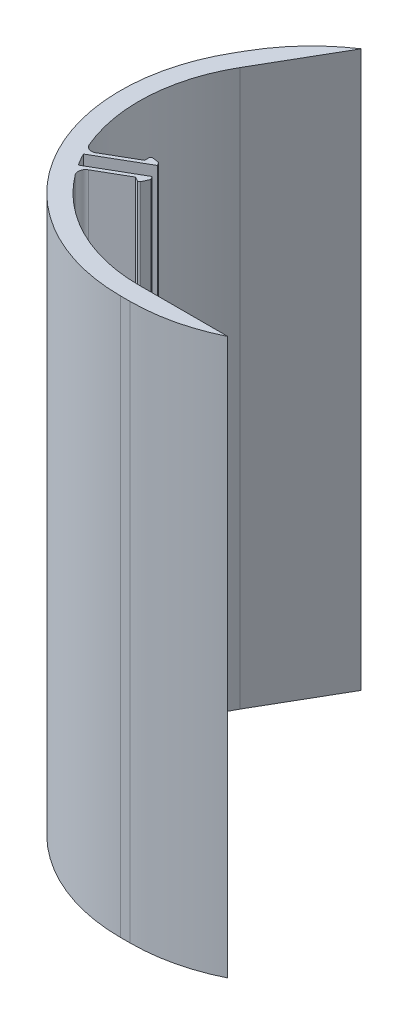
from build123d import *

# Parameters (mm, degrees)
BOSS_EXTRUDE1_DEPTH     = 150
FILLET1_R               = 48
CUT_EXTRUDE1_DEPTH      = 201
CUT_EXTRUDE1_DEPTH_BACK = 201
BOSS_EXTRUDE2_DEPTH     = 150
FILLET2_R               = 48
BOSS_EXTRUDE3_DEPTH     = 150
FILLET3_R               = 2
FILLET4_R               = 0.5


with BuildPart() as part:
    # Sketch1 → Boss-Extrude1 (new body)
    with BuildSketch(Plane(origin=(0, 0, 0), x_dir=(1, 0, 0), z_dir=(0, 1, 0))):
        Polygon((0, 0), (50, 86.602540378), (100, 0), align=None)
    extrude(amount=BOSS_EXTRUDE1_DEPTH)

    # Fillet1
    fillet1_edges = [part.edges().sort_by_distance(p)[0] for p in [
        (0, 75, 0),
    ]]
    fillet(fillet1_edges, radius=FILLET1_R)

    # Sketch3 → Cut-Extrude1 (cut, two sides: drawn at the far end of the back side and taken through both)
    with BuildSketch(Plane.XZ.offset(-CUT_EXTRUDE1_DEPTH_BACK)):
        with BuildLine():
            Line((45.899346401, -69.5), (52.886751346, -81.602540378))
            Line((52.886751346, -81.602540378), (97.113248654, -5))
            Line((97.113248654, -5), (83.138438763, -5))
            ThreePointArc((83.138438763, -5), (45.899346401, -26.5), (45.899346401, -69.5))
        make_face()
    extrude(amount=CUT_EXTRUDE1_DEPTH + CUT_EXTRUDE1_DEPTH_BACK, mode=Mode.SUBTRACT)

    # Sketch4 → Boss-Extrude2 (add)
    with BuildSketch(Plane(origin=(0, 0, 0), x_dir=(1, 0, 0), z_dir=(0, 1, 0))):
        Polygon((50, 86.602540378), (57.886751346, 90.262794416), (52.886751346, 81.602540378), align=None)
        Polygon((97.113248654, 5), (100, 0), (107.113248654, 5), align=None)
    extrude(amount=BOSS_EXTRUDE2_DEPTH)

    # Fillet2
    # the kernel refuses this fillet: 48 mm, written as the material it takes off along each edge
    with BuildSketch(Plane(origin=(50, -35.543700884, -86.602540378), x_dir=(-0.5000000000000046, 0, 0.8660254037844362), z_dir=(0, 1, 0))) as fillet2_piece_1:
        with BuildLine():
            CenterArc((14.217480354, 48), FILLET2_R, 243.615670251, 26.384329749)
            Line((-7.113248654, 5), (-7.539863234, 4.14))
            ThreePointArc((-7.539863234, 4.14), (-4.108682958, 1.714613937), (-0.552058631, -0.785386063))
            Line((-0.552058631, -0.785386063), (0, -0.96))
            Line((0, -0.96), (14.217480354, -0.96))
            Line((14.217480354, -0.96), (14.217480354, 0))
        make_face()
    extrude(amount=221.087401768, mode=Mode.SUBTRACT)
    with BuildSketch(Plane(origin=(100, -35.543700884, 0), x_dir=(-1, 0, 0), z_dir=(0, 1, 0))) as fillet2_piece_2:
        with BuildLine():
            CenterArc((14.217480354, -48), FILLET2_R, 90, 26.384329749)
            Line((-7.113248654, -5), (-7.539863234, -4.14))
            ThreePointArc((-7.539863234, -4.14), (-4.108682958, -1.714613937), (-0.552058631, 0.785386063))
            Line((-0.552058631, 0.785386063), (0, 0.96))
            Line((0, 0.96), (14.217480354, 0.96))
            Line((14.217480354, 0.96), (14.217480354, 0))
        make_face()
    extrude(amount=221.087401768, mode=Mode.SUBTRACT)

    # Sketch5 → Boss-Extrude3 (add)
    with BuildSketch(Plane(origin=(0, 0, 0), x_dir=(1, 0, 0), z_dir=(0, 1, 0))):
        Polygon((54.717765705, 36.671999128), (57.142636836, 36.339948321), (57.642636836, 35.473922917), (43.850262737, 27.510892018), (43.385383074, 28.397194158), (54.717765705, 34.939948321), align=None)
        Polygon((59.542636836, 32.183026382), (60.042636836, 31.317000979), (58.944560624, 28.950975575), (57.444560624, 29.817000979), (45.904890393, 23.154569264), (45.509810975, 24.081170595), align=None)
    extrude(amount=BOSS_EXTRUDE3_DEPTH)

    # Fillet3
    fillet3_edges = [part.edges().sort_by_distance(p)[0] for p in [
        (44.534132149, 75, -29.060424746),
        (47.434132149, 75, -24.037477404),
    ]]
    fillet(fillet3_edges, radius=FILLET3_R)

    # Fillet4
    fillet4_edges = [part.edges().sort_by_distance(p)[0] for p in [
        (54.717765705, 75, -36.671999128),
        (58.944560624, 75, -28.950975575),
    ]]
    fillet(fillet4_edges, radius=FILLET4_R)


solid = part.part
